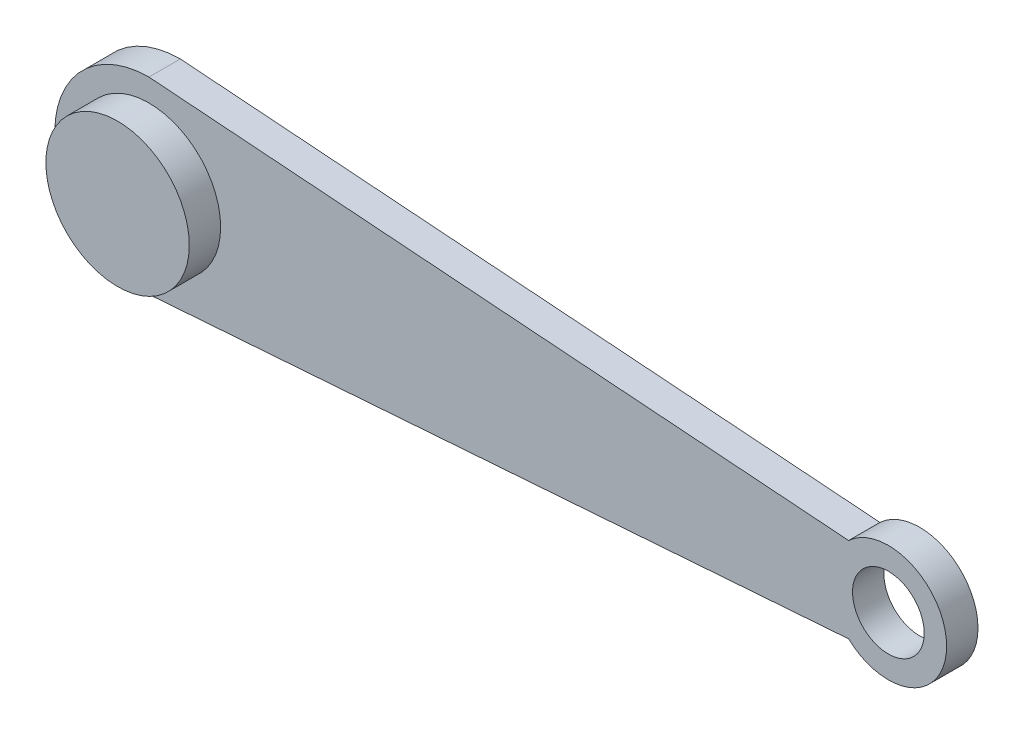
from build123d import *

# Parameters (mm, degrees)
BOSS_EXTRUDE2_DEPTH = 7
SKETCH6_10_R        = 16
BOSS_EXTRUDE3_DEPTH = 14
SKETCH6_11_R        = 8
CUT_EXTRUDE1_DEPTH  = 180.780421626


with BuildPart() as part:
    # Sketch6 → Boss-Extrude2 (new body)
    with BuildSketch(Plane.XY):
        with BuildLine():
            Line((0, -21), (156.125880325, -9.5))
            ThreePointArc((156.125880325, -9.5), (178, 0), (156.125880325, 9.5))
            Line((156.125880325, 9.5), (0, 21))
            ThreePointArc((0, 21), (-21, 0), (0, -21))
        make_face()
    extrude(amount=BOSS_EXTRUDE2_DEPTH)

    # Sketch6<10> → Boss-Extrude3 (add)
    with BuildSketch(Plane.XY):
        Circle(SKETCH6_10_R)
    extrude(amount=BOSS_EXTRUDE3_DEPTH)

    # Sketch6<11> → Cut-Extrude1 (cut, through all)
    with BuildSketch(Plane.XY):
        with Locations((165, 0)):
            Circle(SKETCH6_11_R)
    extrude(amount=CUT_EXTRUDE1_DEPTH, mode=Mode.SUBTRACT)


solid = part.part
